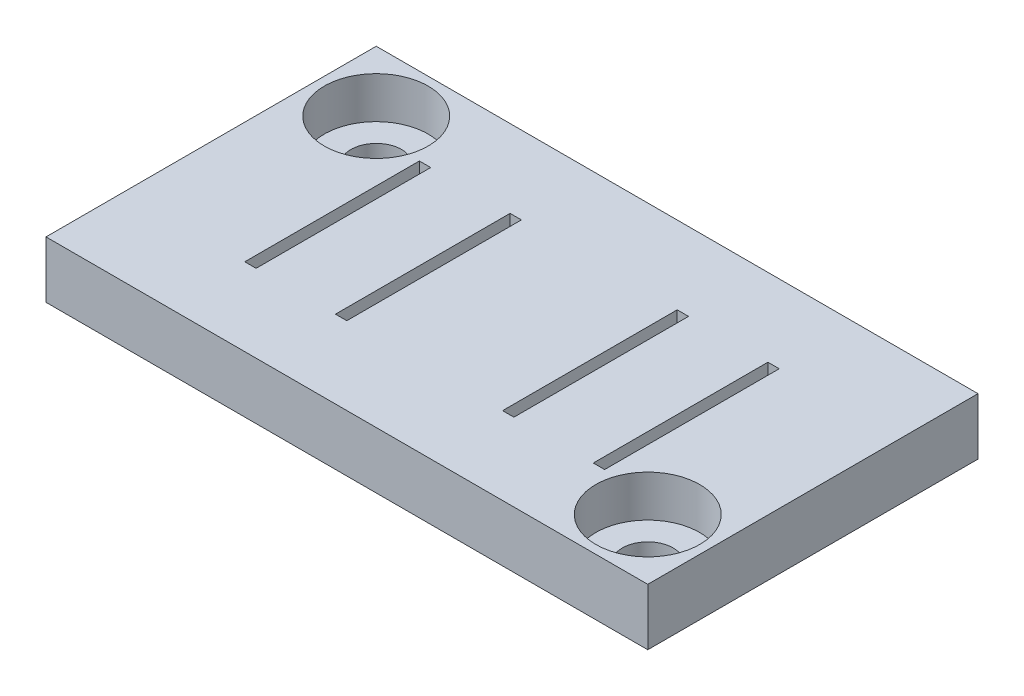
from build123d import *

# Parameters (mm, degrees)
SKETCH1_W           = 40.44093781
SKETCH1_H           = 22.193197578
BOSS_EXTRUDE1_DEPTH = 3.81
SKETCH3_R           = 3.4925
CUT_EXTRUDE3_DEPTH  = 2.794
SKETCH3_4_R         = 1.7018
CUT_EXTRUDE4_DEPTH  = 24.377723743
SKETCH7_W           = 0.762
SKETCH7_H           = 11.7348
CUT_EXTRUDE5_DEPTH  = 24.377723743


with BuildPart() as part:
    # Sketch1 → Boss-Extrude1 (new body)
    with BuildSketch(Plane(origin=(0, 0, 0), x_dir=(1, 0, 0), z_dir=(0, 1, 0))):
        Rectangle(SKETCH1_W, SKETCH1_H)
    extrude(amount=BOSS_EXTRUDE1_DEPTH)

    # Sketch3 → Cut-Extrude3 (cut)
    with BuildSketch(Plane(origin=(0, 3.81, 0), x_dir=(1, 0, 0), z_dir=(0, 1, 0))):
        with Locations((-16.156468905, 7.032598789)):
            Circle(SKETCH3_R)
        with Locations((16.156468905, -7.032598789)):
            Circle(SKETCH3_R)
    extrude(amount=-CUT_EXTRUDE3_DEPTH, mode=Mode.SUBTRACT)

    # Sketch3<4> → Cut-Extrude4 (cut, through all)
    with BuildSketch(Plane(origin=(0, 3.81, 0), x_dir=(1, 0, 0), z_dir=(0, 1, 0))):
        with Locations((-16.156468905, 7.032598789)):
            Circle(SKETCH3_4_R)
        with Locations((16.156468905, -7.032598789)):
            Circle(SKETCH3_4_R)
    extrude(amount=-CUT_EXTRUDE4_DEPTH, mode=Mode.SUBTRACT)

    # Sketch7 → Cut-Extrude5 (cut, through all)
    with BuildSketch(Plane(origin=(0, 3.81, 0), x_dir=(1, 0, 0), z_dir=(0, 1, 0))):
        with Locations((-11.711468905, 0)):
            Rectangle(SKETCH7_W, SKETCH7_H)
        with Locations((-5.615468905, 0)):
            Rectangle(SKETCH7_W, SKETCH7_H)
        with Locations((11.711468905, 0)):
            Rectangle(SKETCH7_W, SKETCH7_H)
        with Locations((5.615468905, 0)):
            Rectangle(SKETCH7_W, SKETCH7_H)
    extrude(amount=-CUT_EXTRUDE5_DEPTH, mode=Mode.SUBTRACT)


solid = part.part
